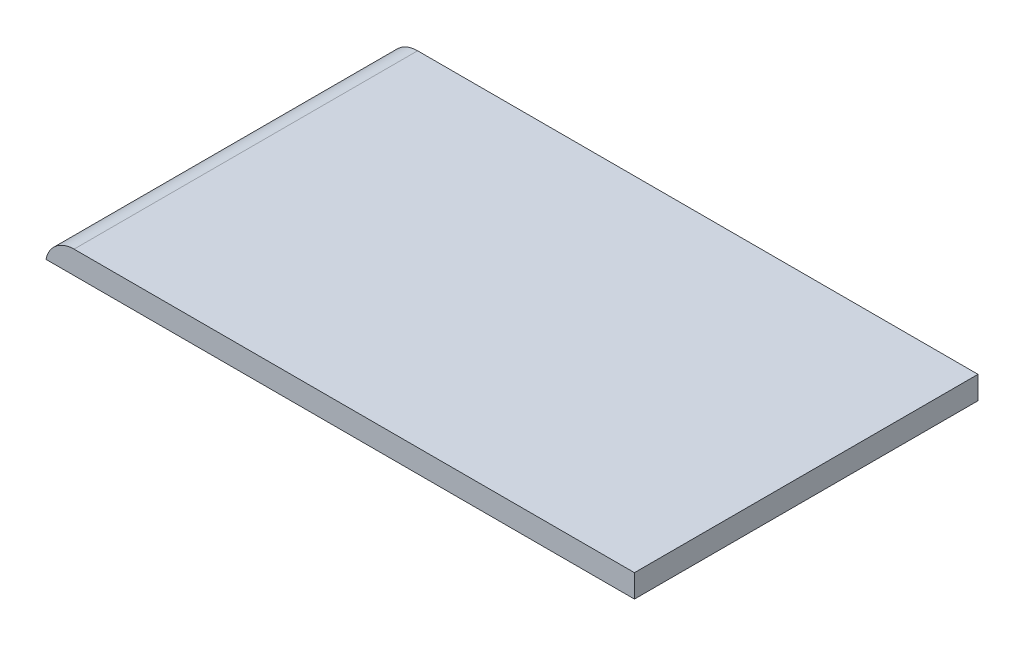
from build123d import *

# Parameters (mm, degrees)
SKETCH_1_W      = 51.383356777
SKETCH_1_H      = 30
EXTRUDE_1_DEPTH = 2
FILLET_1_R      = 2.5


with BuildPart() as part:
    # Эскиз1 → Бобышка-Вытянуть1 (new body)
    with BuildSketch(Plane(origin=(0, 0, 0), x_dir=(1, 0, 0), z_dir=(0, 1, 0))):
        with Locations((-36.298419233, -34.497792834)):
            Rectangle(SKETCH_1_W, SKETCH_1_H)
    extrude(amount=EXTRUDE_1_DEPTH)

    # Скругление1
    # the kernel refuses this fillet: 2.5 mm, written as the material it takes off along each edge
    with BuildSketch(Plane(origin=(-61.990097621, 2, 13.374068477), x_dir=(1.5667467323505199e-12, -1.0, 0), z_dir=(0, 0, 1))) as fillet_1_piece_1:
        with BuildLine():
            CenterArc((2.5, 2.449489743), FILLET_1_R, 180, 78.463040967)
            Line((0, 2.449489743), (-0.05, 2.449489743))
            Line((-0.05, 2.449489743), (-0.05, 0))
            Line((-0.05, 0), (0, -0.05))
            ThreePointArc((0, -0.05), (1, -0.05), (1.99, -0.048989795))
            Line((1.99, -0.048989795), (2, 0))
        make_face()
    extrude(amount=42.247448714, mode=Mode.SUBTRACT)


solid = part.part
